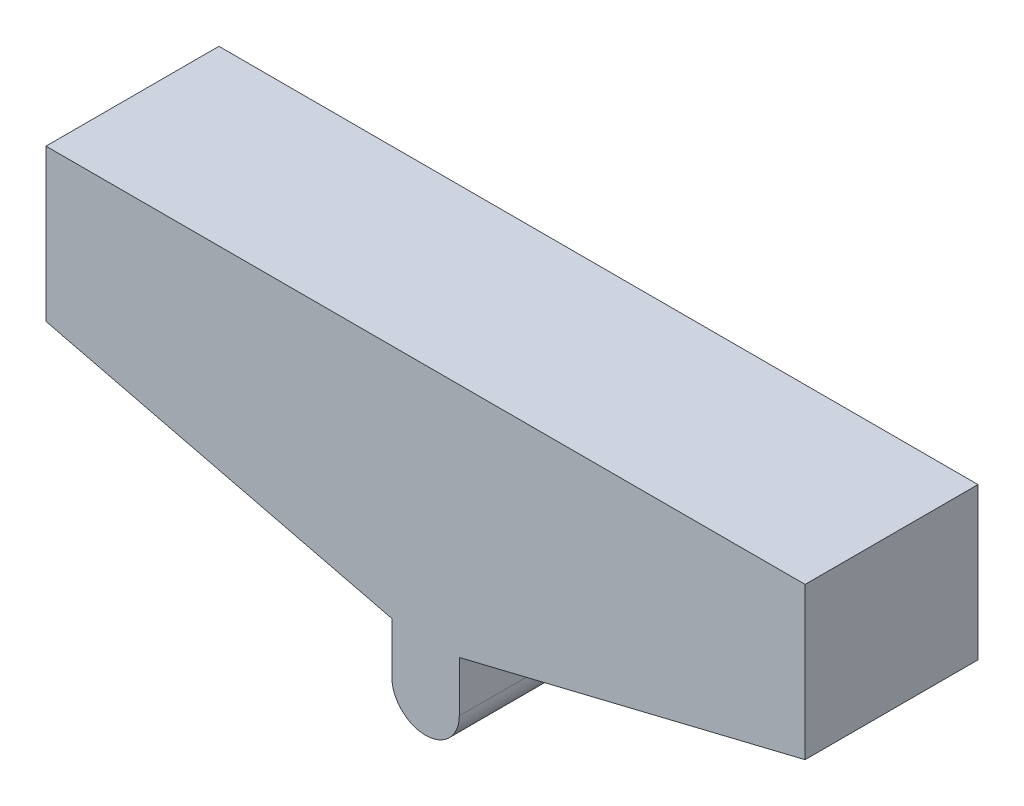
from build123d import *

# Parameters (mm, degrees)
SKETCH1_W           = 15
SKETCH1_H           = 6
SKETCH1_W_2         = 8
SKETCH1_H_2         = 20
BOSS_EXTRUDE1_DEPTH = 14
SKETCH3_W           = 15
SKETCH3_H           = 6
SKETCH3_W_2         = 8
SKETCH3_H_2         = 20
BOSS_EXTRUDE2_DEPTH = 6.5
FILLET1_R           = 4


with BuildPart() as part:
    # Sketch1 → Boss-Extrude1 (new body)
    # profile 1 of 6: a face of its own
    with BuildSketch(Plane.XY):
        Polygon((-4, -9), (4, -9), (45, -9), (45, 9), (-45, 9), (-45, -9), align=None)
        with Locations((-15, 0)):
            Rectangle(SKETCH1_W, SKETCH1_H, mode=Mode.SUBTRACT)
        with Locations((15, 0)):
            Rectangle(SKETCH1_W, SKETCH1_H, mode=Mode.SUBTRACT)
    # profile 2 of 6: a face of its own
    with BuildSketch(Plane.XY):
        with Locations((0, -19)):
            Rectangle(SKETCH1_W_2, SKETCH1_H_2)
    # profile 3 of 6: a face of its own
    with BuildSketch(Plane.XY):
        with Locations((-15, 0)):
            Rectangle(SKETCH1_W, SKETCH1_H)
    # profile 4 of 6: a face of its own
    with BuildSketch(Plane.XY):
        with Locations((15, 0)):
            Rectangle(SKETCH1_W, SKETCH1_H)
    # profile 5 of 6: a face of its own
    with BuildSketch(Plane.XY):
        Polygon((45, -9), (4, -9), (4, -19), align=None)
    # profile 6 of 6: a face of its own
    with BuildSketch(Plane.XY):
        Polygon((-4, -19), (-4, -9), (-45, -9), align=None)
    extrude(amount=BOSS_EXTRUDE1_DEPTH)

    # Sketch3 → Boss-Extrude2 (add)
    # profile 1 of 2: a face of its own
    with BuildSketch(Plane.XY):
        Polygon((-4, -9), (4, -9), (45, -9), (45, 9), (-45, 9), (-45, -9), align=None)
        with Locations((-15, 0)):
            Rectangle(SKETCH3_W, SKETCH3_H, mode=Mode.SUBTRACT)
        with Locations((15, 0)):
            Rectangle(SKETCH3_W, SKETCH3_H, mode=Mode.SUBTRACT)
    # profile 2 of 2: a face of its own
    with BuildSketch(Plane.XY):
        with Locations((0, -19)):
            Rectangle(SKETCH3_W_2, SKETCH3_H_2)
    extrude(amount=-BOSS_EXTRUDE2_DEPTH)

    # Fillet1
    fillet1_edges = [part.edges().sort_by_distance(p)[0] for p in [
        (-4, -29, 3.75),
        (4, -29, 3.75),
    ]]
    fillet(fillet1_edges, radius=FILLET1_R - 0.0001)  # a hair under: the kernel refuses the full size


solid = part.part
